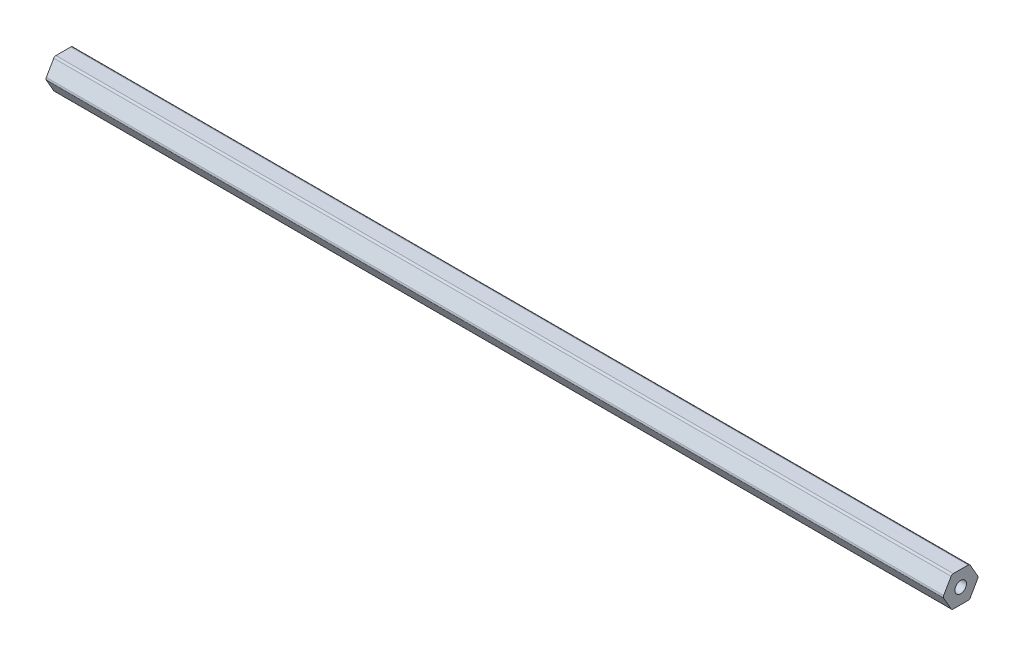
from build123d import *

# Parameters (mm, degrees)
SKETCH1_R           = 2.38125
BOSS_EXTRUDE1_DEPTH = 371.475


with BuildPart() as part:
    # Sketch1 → Boss-Extrude1 (new body)
    with BuildSketch(Plane(origin=(0, 0, 0), x_dir=(0, 0, -1), z_dir=(1, 0, 0))):
        with BuildLine():
            Line((7.039054482, 0.508), (3.959468146, 5.842))
            ThreePointArc((3.959468146, 5.842), (3.587586336, 6.21388181), (3.079586336, 6.35))
            Line((3.079586336, 6.35), (-3.079586336, 6.35))
            ThreePointArc((-3.079586336, 6.35), (-3.587586336, 6.21388181), (-3.959468146, 5.842))
            Line((-3.959468146, 5.842), (-7.039054482, 0.508))
            ThreePointArc((-7.039054482, 0.508), (-7.175172672, 0), (-7.039054482, -0.508))
            Line((-7.039054482, -0.508), (-3.959468146, -5.842))
            ThreePointArc((-3.959468146, -5.842), (-3.587586336, -6.21388181), (-3.079586336, -6.35))
            Line((-3.079586336, -6.35), (3.079586336, -6.35))
            ThreePointArc((3.079586336, -6.35), (3.587586336, -6.21388181), (3.959468146, -5.842))
            Line((3.959468146, -5.842), (7.039054482, -0.508))
            ThreePointArc((7.039054482, -0.508), (7.175172672, 0), (7.039054482, 0.508))
        make_face()
        Circle(SKETCH1_R, mode=Mode.SUBTRACT)
    extrude(amount=BOSS_EXTRUDE1_DEPTH)


solid = part.part
